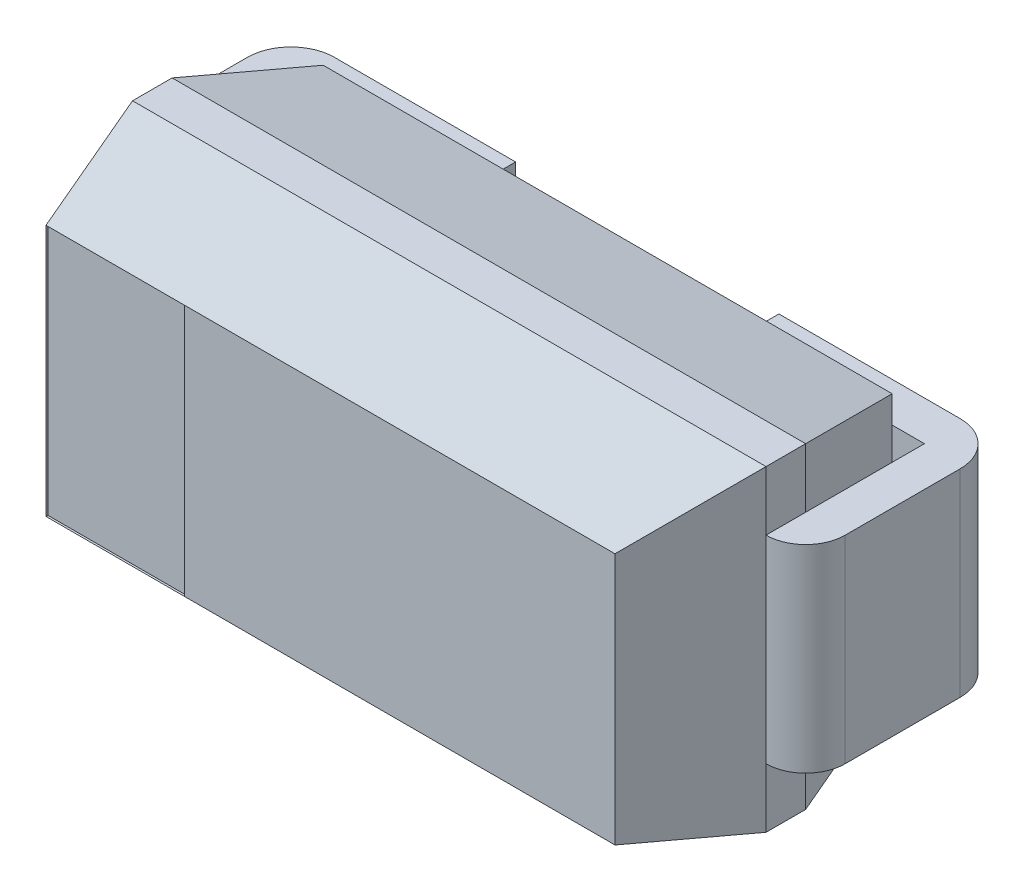
from build123d import *
from OCP.BRepFilletAPI import BRepFilletAPI_MakeChamfer

# Parameters (mm, degrees)
SKETCH_1_W           = 3.2
SKETCH_1_H           = 1.6
EXTRUDE_1_DEPTH      = 1.4
CHAMFER_1_SIZE       = 0.6
CHAMFER_1_SIZE2      = 0.163
CHAMFER_2_SIZE       = 0.163
CHAMFER_2_SIZE2      = 0.6
EXTRUDE_2_DEPTH      = 0.5
EXTRUDE_2_DEPTH_BACK = 0.5
SKETCH_3_W           = 0.7
SKETCH_3_H           = 1.274
CUT_EXTRUDE_1_DEPTH  = 0.01


with BuildPart() as part:
    # Эскиз1 → Бобышка-Вытянуть1 (new body)
    with BuildSketch(Plane.XY.offset(0.2)):
        Rectangle(SKETCH_1_W, SKETCH_1_H)
    extrude(amount=EXTRUDE_1_DEPTH)

    # Фаска1: one chamfer whose edges measure the first distance from different faces: ONE call of the kernel's chamfer builder (chamfer() names one face for all edges)
    chamfer_1_edges_1 = [part.edges().sort_by_distance(p)[0] for p in [
        (0, 0.8, 1.6),
    ]]
    chamfer_1_side_1 = [part.faces().sort_by_distance(p)[0] for p in [
        (0, 0.8, 0.9),
    ]]
    chamfer_1_edges_2 = [part.edges().sort_by_distance(p)[0] for p in [
        (1.6, 0, 1.6),
    ]]
    chamfer_1_side_2 = [part.faces().sort_by_distance(p)[0] for p in [
        (1.6, 0, 0.9),
    ]]
    chamfer_1_edges_3 = [part.edges().sort_by_distance(p)[0] for p in [
        (0, -0.8, 1.6),
    ]]
    chamfer_1_side_3 = [part.faces().sort_by_distance(p)[0] for p in [
        (0, -0.8, 0.9),
    ]]
    chamfer_1_edges_4 = [part.edges().sort_by_distance(p)[0] for p in [
        (-1.6, 0, 1.6),
    ]]
    chamfer_1_side_4 = [part.faces().sort_by_distance(p)[0] for p in [
        (-1.6, 0, 0.9),
    ]]
    chamfer_1 = BRepFilletAPI_MakeChamfer(part.part.solid().wrapped)
    for e in chamfer_1_edges_1:
        chamfer_1.Add(CHAMFER_1_SIZE, CHAMFER_1_SIZE2, e.wrapped, chamfer_1_side_1[0].wrapped)  # the first distance lies on this face
    for e in chamfer_1_edges_2:
        chamfer_1.Add(CHAMFER_1_SIZE, CHAMFER_1_SIZE2, e.wrapped, chamfer_1_side_2[0].wrapped)  # the first distance lies on this face
    for e in chamfer_1_edges_3:
        chamfer_1.Add(CHAMFER_1_SIZE, CHAMFER_1_SIZE2, e.wrapped, chamfer_1_side_3[0].wrapped)  # the first distance lies on this face
    for e in chamfer_1_edges_4:
        chamfer_1.Add(CHAMFER_1_SIZE, CHAMFER_1_SIZE2, e.wrapped, chamfer_1_side_4[0].wrapped)  # the first distance lies on this face
    add(Compound.cast(chamfer_1.Shape()), mode=Mode.REPLACE)

    # Фаска2
    chamfer_2_edges = [part.edges().sort_by_distance(p)[0] for p in [
        (1.6, 0, 0.2),
        (0, 0.8, 0.2),
        (0, -0.8, 0.2),
        (-1.6, 0, 0.2),
    ]]
    chamfer_2_side = [part.faces().sort_by_distance(p)[0] for p in [
        (0, 0, 0.2),
    ]]
    chamfer(chamfer_2_edges, length=CHAMFER_2_SIZE, length2=CHAMFER_2_SIZE2, reference=chamfer_2_side[0])

    # Эскиз3 → Вырез-Вытянуть1 (cut)
    with BuildSketch(Plane.XY.offset(1.6)):
        with Locations((-1.087, 0)):
            Rectangle(SKETCH_3_W, SKETCH_3_H)
    extrude(amount=-CUT_EXTRUDE_1_DEPTH, mode=Mode.SUBTRACT)


with BuildPart() as body_2:
    # Эскиз2 → Бобышка-Вытянуть2 (new, two sides: drawn at the far end of the back side and taken through both)
    with BuildSketch(Plane(origin=(0, 0, 0), x_dir=(1, 0, 0), z_dir=(0, 1, 0)).offset(-EXTRUDE_2_DEPTH_BACK)):
        with BuildLine():
            Line((-1.6, -0.2), (-1.6, -0.8))
            Line((-1.6, -0.8), (-1.6, -1))
            ThreePointArc((-1.6, -1), (-1.741421356, -0.941421356), (-1.8, -0.8))
            Line((-1.8, -0.8), (-1.8, -0.22))
            ThreePointArc((-1.8, -0.22), (-1.735563492, -0.064436508), (-1.58, 0))
            Line((-1.58, 0), (-0.665, 0))
            Line((-0.665, 0), (-0.665, -0.2))
            Line((-0.665, -0.2), (-1.6, -0.2))
        make_face()
    extrude(amount=EXTRUDE_2_DEPTH + EXTRUDE_2_DEPTH_BACK)


with BuildPart() as body_3:
    # Зеркальное отражение1: mirrored copy
    add(body_2.part.mirror(Plane(origin=(0, 0, 0), x_dir=(0, 0, 1), z_dir=(1, 0, 0))))


solid = Compound([part.part, body_2.part, body_3.part])
